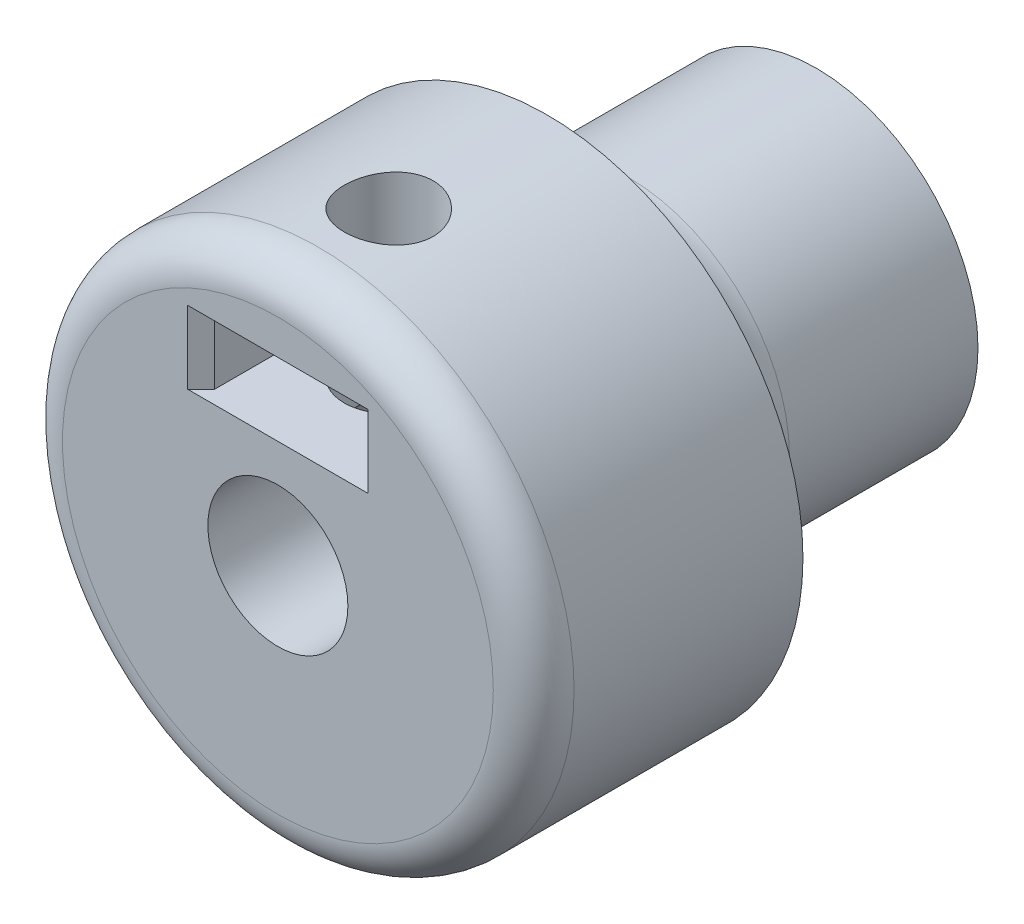
from build123d import *
from OCP.BRepFilletAPI import BRepFilletAPI_MakeChamfer

# Parameters (mm, degrees)
SKETCH1_R               = 9.5
BOSS_EXTRUDE1_DEPTH     = 10
SKETCH6_R               = 6
BOSS_EXTRUDE2_DEPTH     = 10
SKETCH2_R               = 2.6
CUT_EXTRUDE1_DEPTH      = 10
SKETCH3_R               = 2.15
CUT_EXTRUDE2_DEPTH      = 17.748134224
CUT_EXTRUDE3_DEPTH      = 3.3
CUT_EXTRUDE4_DEPTH      = 2.7
CUT_EXTRUDE5_REACH      = 25.479
CUT_EXTRUDE5_END_RADIUS = 2.6
SKETCH7_R               = 1.65
FILLET1_R               = 3
CHAMFER1_SIZE           = 0.356629571
CHAMFER1_SIZE_2         = 0.5
CHAMFER2_SIZE           = 0.5
FILLET2_R               = 1.5


with BuildPart() as part:
    # Sketch1 → Boss-Extrude1 (new body)
    with BuildSketch(Plane.XY):
        Circle(SKETCH1_R)
    extrude(amount=BOSS_EXTRUDE1_DEPTH)

    # Sketch6 → Boss-Extrude2 (add)
    with BuildSketch(Plane(origin=(0, 0, 0), x_dir=(-1, 0, 0), z_dir=(0, 0, -1))):
        with Locations(Location((0, 0, 0), (0, 0, 180))):
            Circle(SKETCH6_R)
    extrude(amount=BOSS_EXTRUDE2_DEPTH)

    # Sketch2 → Cut-Extrude1 (cut)
    with BuildSketch(Plane.XY.offset(10)):
        Circle(SKETCH2_R)
    extrude(amount=-CUT_EXTRUDE1_DEPTH, mode=Mode.SUBTRACT)

    # Sketch3 → Cut-Extrude2 (cut, through all)
    with BuildSketch(Plane.XY):
        Circle(SKETCH3_R)
    extrude(amount=-CUT_EXTRUDE2_DEPTH, mode=Mode.SUBTRACT)

    # Sketch4 → Cut-Extrude3 (cut)
    with BuildSketch(Plane(origin=(0, 0, -7), x_dir=(-1, 0, 0), z_dir=(0, 0, -1))):
        Polygon((-3.65, -9.105308986), (3.65, -9.105308986), (3.65, 2.107328483), (0, 4.214656965), (-3.65, 2.107328483), align=None)
    extrude(amount=-CUT_EXTRUDE3_DEPTH, mode=Mode.SUBTRACT)

    # Sketch5 → Cut-Extrude4 (cut)
    with BuildSketch(Plane(origin=(0, 4, 0), x_dir=(-1, 0, 0), z_dir=(0, 1, 0))):
        Polygon((-2.85, 11.49401058), (2.85, 11.49401058), (2.85, 4.354551733), (0, 2.709103466), (-2.85, 4.354551733), align=None)
    extrude(amount=CUT_EXTRUDE4_DEPTH, mode=Mode.SUBTRACT)

    # Cut-Extrude5: up to this cylinder (the profile starts outside it)
    cut_extrude5_end = Plane(origin=(0, 0, 5.88453), z_dir=(0, 0, 1)) * Cylinder(CUT_EXTRUDE5_END_RADIUS, 57.158, mode=Mode.PRIVATE)
    # Sketch7 → Cut-Extrude5 (cut, up to the surface)
    with BuildSketch(Plane(origin=(0, 9.5, 0), x_dir=(-1, 0, 0), z_dir=(0, 1, 0)), mode=Mode.PRIVATE) as cut_extrude5_sk1:
        with Locations(Location((0, 5.884529946, 0), (0, 0, 90))):
            Circle(SKETCH7_R)
    cut_extrude5_tool1 = extrude(cut_extrude5_sk1.sketch, amount=-CUT_EXTRUDE5_REACH, mode=Mode.PRIVATE) - cut_extrude5_end
    add(cut_extrude5_tool1.solids().sort_by_distance((0, 9.5, 5.88453))[0], mode=Mode.SUBTRACT)

    # Fillet1
    fillet1_edges = [part.edges().sort_by_distance(p)[0] for p in [
        (-6, 0, 0),
    ]]
    fillet(fillet1_edges, radius=FILLET1_R)

    # Chamfer1
    chamfer1_edges_1 = [part.edges().sort_by_distance(p)[0] for p in [
        (-3.65, -4.762089877, -5.35),
    ]]
    chamfer1_side_1 = [part.faces().sort_by_distance(p)[0] for p in [
        (-3.655661007, -4.757750884, -5.35),
    ]]
    chamfer1_edges_2 = [part.edges().sort_by_distance(p)[0] for p in [
        (3.65, -4.762089877, -5.35),
    ]]
    chamfer1_side_2 = [part.faces().sort_by_distance(p)[0] for p in [
        (3.655661007, -4.757750884, -5.35),
    ]]
    chamfer1 = BRepFilletAPI_MakeChamfer(part.part.solid().wrapped)
    for e in chamfer1_edges_1:
        chamfer1.Add(CHAMFER1_SIZE - 0.0004, CHAMFER1_SIZE_2 - 0.0004, e.wrapped, chamfer1_side_1[0].wrapped)
    for e in chamfer1_edges_2:
        chamfer1.Add(CHAMFER1_SIZE - 0.0004, CHAMFER1_SIZE_2 - 0.0004, e.wrapped, chamfer1_side_2[0].wrapped)
    add(Compound.cast(chamfer1.Shape()), mode=Mode.REPLACE)  # a hair under: the kernel refuses the full size

    # Chamfer2
    chamfer2_edges = [part.edges().sort_by_distance(p)[0] for p in [
        (-2.85, 5.35, 10),
        (2.85, 5.35, 10),
    ]]
    chamfer(chamfer2_edges, length=CHAMFER2_SIZE)

    # Fillet2
    fillet2_edges = [part.edges().sort_by_distance(p)[0] for p in [
        (-9.5, 0, 10),
    ]]
    fillet(fillet2_edges, radius=FILLET2_R)


solid = part.part
